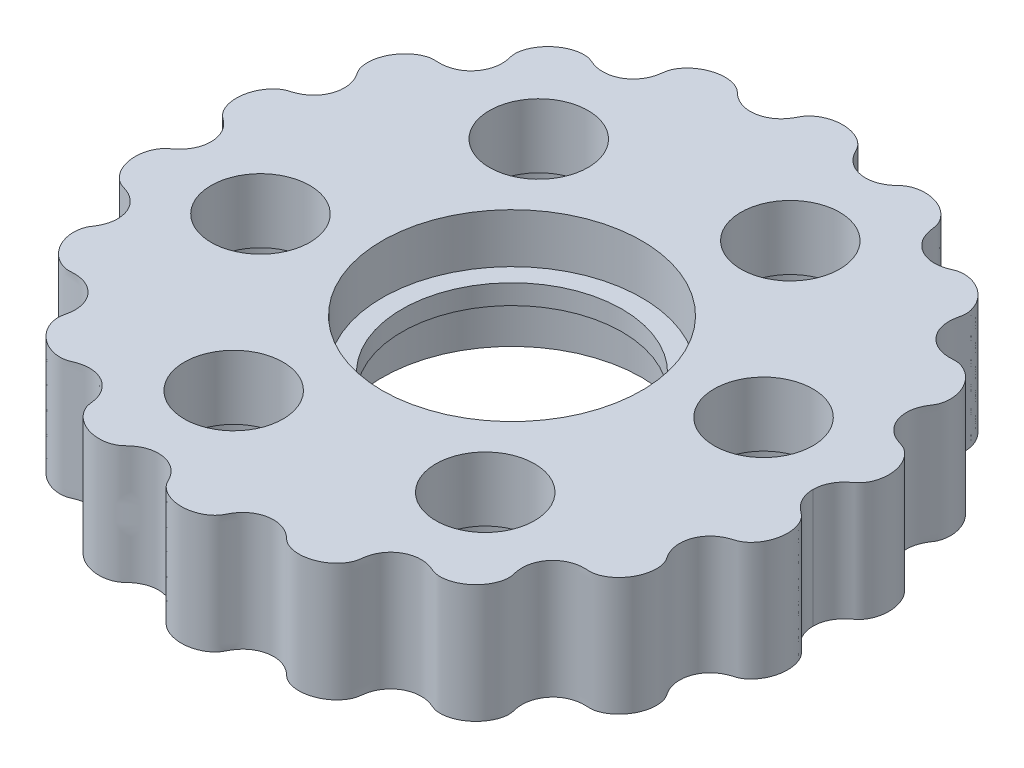
from build123d import *

# Parameters (mm, degrees)
BOSS_EXTRUDE1_DEPTH = 12
SKETCH2_R           = 13.15
CUT_EXTRUDE1_DEPTH  = 5
CUT_EXTRUDE2_START  = -5
SKETCH3_R           = 13.15
CUT_EXTRUDE2_DEPTH  = 5
SKETCH4_R           = 11.15
CUT_EXTRUDE3_DEPTH  = 49.565975451
SKETCH5_R           = 6.15
CUT_EXTRUDE4_DEPTH  = 5.5
SKETCH7_R           = 5
CUT_EXTRUDE5_DEPTH  = 48.506883401
CIRPATTERN1_COUNT   = 6


# Read off the part's stored shape, not the designer's step: Boss-Extrude1
with BuildPart() as part:
    # Boss-Extrude1 outline → Boss-Extrude1 (new body)
    with BuildSketch(Plane(origin=(0, 0, 0), x_dir=(1, 0, 0), z_dir=(0, 1, 0))):
        with BuildLine():
            add(Edge.make_bspline(
                [(-30.499999085, 0), (-30.499999175, -0.010492819), (-30.500691598, -0.162801588), (-30.521411377, -0.456943393), (-30.60687887, -0.883817919), (-30.80003143, -1.368056975), (-31.044007723, -1.775169688), (-31.325703126, -2.125056175), (-31.590756879, -2.382187589), (-31.849606625, -2.588359591), (-32.094052825, -2.769126177), (-32.284530428, -2.941107432), (-32.45615239, -3.146584597), (-32.609425913, -3.378646405), (-32.763947309, -3.674818071), (-32.903571398, -4.039160413), (-33.045989809, -4.621618508), (-33.087120433, -5.449381257), (-32.937194441, -6.258982918), (-32.61230154, -7.000333705), (-32.271226262, -7.494720192), (-32.019908426, -7.778290863), (-31.769218305, -8.003024352), (-31.529780832, -8.173830265), (-31.276753274, -8.311619838), (-31.011944101, -8.404178458), (-30.749402322, -8.480858964), (-30.497667969, -8.571876808), (-30.241927917, -8.683548266), (-29.986243002, -8.821967156), (-29.676679256, -9.027661698), (-29.331445279, -9.326854778), (-28.992040898, -9.733219087), (-28.704107226, -10.256942243), (-28.522577148, -10.824275994), (-28.452854891, -11.407333385), (-28.488060733, -11.92630102), (-28.589845056, -12.370337834), (-28.716403333, -12.714525216), (-28.836561026, -12.969318867), (-28.962226742, -13.193151466), (-29.085829976, -13.389048228), (-29.220719808, -13.594131406), (-29.340146042, -13.82476592), (-29.430391624, -14.082852476), (-29.493643838, -14.36210599), (-29.532855371, -14.691688028), (-29.535518385, -15.069118274), (-29.484893169, -15.515830574), (-29.35650675, -16.020958669), (-29.092942729, -16.667756875), (-28.709006495, -17.254073331), (-28.241816804, -17.740949419), (-27.690154521, -18.129754208), (-27.28119716, -18.334169834), (-26.885000972, -18.459364675), (-26.517146193, -18.510550206), (-26.221274848, -18.500641833), (-25.856897799, -18.479916929), (-25.491483562, -18.493737102), (-25.127858663, -18.548128201), (-24.702165675, -18.666574341), (-24.288563977, -18.839137858), (-23.843442434, -19.115048674), (-23.410547993, -19.516009595), (-23.065752538, -19.985452755), (-22.819462403, -20.497388778), (-22.683755131, -20.988837886), (-22.631614112, -21.444484037), (-22.637804746, -21.81835899), (-22.669724735, -22.109274444), (-22.715315125, -22.362908346), (-22.764801722, -22.58010395), (-22.816492345, -22.810310944), (-22.842935536, -23.058295646), (-22.836840431, -23.320437872), (-22.800567289, -23.592723848), (-22.724493742, -23.915362284), (-22.593257298, -24.281127511), (-22.386227124, -24.689408547), (-22.085311278, -25.121288655), (-21.606200529, -25.640725559), (-21.04785269, -26.050457906), (-20.450105873, -26.338151172), (-19.871291213, -26.490725482), (-19.506020896, -26.542502949), (-19.16782053, -26.551437218), (-18.861814377, -26.523908301), (-18.565877351, -26.45743559), (-18.291525054, -26.34331334), (-17.958528276, -26.202781675), (-17.54317837, -26.07054566), (-17.030700231, -25.984231535), (-16.424475137, -25.996763262), (-15.820867461, -26.130090758), (-15.249714898, -26.383641646), (-14.739252597, -26.747920188), (-14.315548374, -27.203217538), (-13.994871292, -27.724976088), (-13.808937144, -28.217614993), (-13.713611458, -28.648871834), (-13.668418356, -29.011297177), (-13.629929171, -29.306946931), (-13.539294967, -29.597067659), (-13.410068961, -29.876144041), (-13.227782837, -30.173224783), (-12.986290492, -30.478430939), (-12.543832541, -30.913946499), (-11.95970063, -31.297261567), (-11.282105556, -31.574526313), (-10.452014742, -31.730414717), (-9.839096654, -31.730848992), (-9.309241563, -31.638989547), (-8.867289361, -31.479831305), (-8.578045527, -31.335516465), (-8.320012243, -31.149083082), (-8.097371044, -30.930993351), (-7.821799247, -30.690653756), (-7.47292356, -30.437834205), (-7.01694869, -30.200071645), (-6.443080974, -30.025249665), (-5.83418155, -29.964452287), (-5.224498816, -30.024481113), (-4.640821732, -30.202402896), (-4.09682771, -30.493163872), (-3.62777909, -30.878506743), (-3.29210175, -31.283207956), (-3.059200328, -31.663110182), (-2.9001788, -31.981774035), (-2.761353801, -32.235427892), (-2.579273144, -32.464858975), (-2.369706257, -32.672026051), (-2.09703076, -32.886892763), (-1.756270245, -33.095004832), (-1.188568065, -33.348068895), (-0.365615859, -33.53430372), (0.473440825, -33.52219997), (1.273147664, -33.318270639), (1.81456259, -33.062504094), (2.135143608, -32.859561837), (2.395795297, -32.648529952), (2.600080171, -32.441319452), (2.777665184, -32.210325215), (2.91331922, -31.95420075), (3.076217138, -31.632283867), (3.311396206, -31.257230813), (3.647275735, -30.860738511), (4.111684864, -30.484715044), (4.645588786, -30.200848431), (5.226183564, -30.024310105), (5.83418553, -29.9644552), (6.443078327, -30.025247732), (7.016950608, -30.200073046), (7.4729222, -30.437833212), (7.821800005, -30.690654309), (8.097370637, -30.930993055), (8.320012458, -31.14908324), (8.578045414, -31.335516382), (8.867289407, -31.47983134), (9.309241528, -31.638989521), (9.83909668, -31.730849011), (10.452014727, -31.730414706), (11.282105566, -31.57452632), (11.959700623, -31.297261561), (12.543832545, -30.913946502), (12.98629049, -30.478430938), (13.227782838, -30.173224784), (13.41006896, -29.87614404), (13.539294968, -29.597067659), (13.629929171, -29.30694693), (13.668418356, -29.011297177), (13.713611458, -28.648871834), (13.808937144, -28.217614993), (13.994871292, -27.724976088), (14.315548374, -27.203217538), (14.739252597, -26.747920188), (15.249714898, -26.383641646), (15.820867461, -26.130090758), (16.424475137, -25.996763262), (17.030700231, -25.984231535), (17.54317837, -26.07054566), (17.958528276, -26.202781675), (18.291525054, -26.34331334), (18.565877351, -26.45743559), (18.861814377, -26.523908301), (19.16782053, -26.551437218), (19.506020896, -26.542502949), (19.871291213, -26.490725482), (20.450105873, -26.338151172), (21.04785269, -26.050457906), (21.606200529, -25.640725559), (22.085311278, -25.121288655), (22.386227124, -24.689408547), (22.593257298, -24.281127511), (22.724493742, -23.915362284), (22.800567289, -23.592723848), (22.836840431, -23.320437872), (22.842935536, -23.058295646), (22.816492345, -22.810310944), (22.764801722, -22.58010395), (22.715315125, -22.362908346), (22.669724735, -22.109274444), (22.637804746, -21.81835899), (22.631614112, -21.444484037), (22.683755131, -20.988837886), (22.819462403, -20.497388778), (23.065752538, -19.985452755), (23.410547993, -19.516009595), (23.843442434, -19.115048674), (24.288563977, -18.839137858), (24.702165675, -18.666574341), (25.127858663, -18.548128201), (25.491483562, -18.493737102), (25.856897799, -18.479916929), (26.221274848, -18.500641833), (26.517146193, -18.510550206), (26.885000972, -18.459364675), (27.28119716, -18.334169834), (27.690154521, -18.129754208), (28.241816804, -17.740949419), (28.709006495, -17.254073331), (29.092942729, -16.667756875), (29.35650675, -16.020958669), (29.484893169, -15.515830574), (29.535518385, -15.069118274), (29.532855371, -14.691688028), (29.493643838, -14.36210599), (29.430391624, -14.082852476), (29.340146042, -13.82476592), (29.220719808, -13.594131406), (29.085829976, -13.389048228), (28.962226742, -13.193151466), (28.836561026, -12.969318867), (28.716403333, -12.714525216), (28.589845056, -12.370337834), (28.488060733, -11.92630102), (28.452854891, -11.407333385), (28.522577148, -10.824275994), (28.704107226, -10.256942243), (28.992040898, -9.733219087), (29.331445279, -9.326854778), (29.676679256, -9.027661698), (29.986243002, -8.821967156), (30.241927917, -8.683548266), (30.497667969, -8.571876808), (30.749402322, -8.480858964), (31.011944101, -8.404178458), (31.276753274, -8.311619838), (31.529780832, -8.173830265), (31.769218305, -8.003024352), (32.019908426, -7.778290863), (32.271226262, -7.494720192), (32.61230154, -7.000333705), (32.937194441, -6.258982918), (33.087120433, -5.449381257), (33.045989809, -4.621618508), (32.903571398, -4.039160413), (32.763947309, -3.674818071), (32.609425913, -3.378646404), (32.45615239, -3.146584598), (32.284530428, -2.941107431), (32.094052825, -2.769126179), (31.849606624, -2.588359587), (31.59075688, -2.382187596), (31.325703124, -2.125056164), (31.044007726, -1.775169702), (30.800031426, -1.368056953), (30.606878876, -0.883817954), (30.521411371, -0.456943359), (30.500691597, -0.162801583), (30.499999177, -0.010492821), (30.499999087, 0)],
                knots=[0.110052273, 0.110052273, 0.110052273, 0.110052273, 0.110052273, 0.110325765, 0.114022142, 0.117722321, 0.121335676, 0.123841108, 0.126346539, 0.129404254, 0.130933112, 0.13246197, 0.134268785, 0.1360756, 0.137887882, 0.139700164, 0.142960539, 0.146220913, 0.153462311, 0.161135349, 0.164140391, 0.167145434, 0.169068277, 0.17099112, 0.172896042, 0.174800963, 0.176543347, 0.178285731, 0.180028114, 0.181770498, 0.183811634, 0.18585277, 0.18970137, 0.193635426, 0.197527317, 0.201332127, 0.205132655, 0.208850144, 0.211007871, 0.213165599, 0.21467506, 0.216184522, 0.217693984, 0.219203446, 0.221069572, 0.222935697, 0.224795639, 0.22665558, 0.229704369, 0.232753158, 0.236476624, 0.240200089, 0.24784116, 0.250878244, 0.253915328, 0.257740893, 0.259700206, 0.261659519, 0.263549239, 0.265438959, 0.269218398, 0.271162142, 0.273105887, 0.276937324, 0.280861097, 0.284727203, 0.28839057, 0.292029512, 0.295588307, 0.297946203, 0.3003041, 0.3017559, 0.303207699, 0.304659499, 0.306111298, 0.307900602, 0.309689905, 0.311474966, 0.313260027, 0.316527057, 0.319794087, 0.323365877, 0.326937666, 0.334884636, 0.337696823, 0.340509011, 0.342495571, 0.344482131, 0.346493459, 0.348504786, 0.350358222, 0.352211657, 0.355918528, 0.359835531, 0.363833606, 0.367915804, 0.371924364, 0.376013451, 0.380068173, 0.384018447, 0.387782933, 0.389665176, 0.391547419, 0.393542886, 0.395538352, 0.397544662, 0.399550971, 0.402605463, 0.405659955, 0.413675299, 0.417599554, 0.421523809, 0.427581515, 0.429547594, 0.431513674, 0.433745812, 0.435977951, 0.437802071, 0.43962619, 0.44327443, 0.447180354, 0.451131412, 0.455168481, 0.459117657, 0.463045972, 0.466931719, 0.471148815, 0.474833175, 0.476675355, 0.478517535, 0.480435451, 0.482353367, 0.484271351, 0.486189335, 0.489462878, 0.492736421, 0.500412802, 0.507997592, 0.511034971, 0.51407235, 0.51596915, 0.517865949, 0.519756263, 0.521646576, 0.52352597, 0.525405365, 0.529164154, 0.533153633, 0.53699803, 0.540882342, 0.544831519, 0.548868587, 0.552819646, 0.55672557, 0.56037381, 0.562197929, 0.564022049, 0.566254188, 0.568486326, 0.570452406, 0.572418485, 0.578476191, 0.582400446, 0.586324701, 0.594340045, 0.597394537, 0.600449029, 0.602455338, 0.604461648, 0.606457114, 0.608452581, 0.610334824, 0.612217067, 0.615981553, 0.619931826, 0.623986549, 0.628075635, 0.632084196, 0.636166393, 0.640164469, 0.644081472, 0.647788343, 0.649641778, 0.651495213, 0.653506541, 0.655517868, 0.657504429, 0.659490989, 0.662303177, 0.665115364, 0.673062334, 0.676634123, 0.680205913, 0.683472943, 0.686739973, 0.688525034, 0.690310094, 0.692099398, 0.693888702, 0.695340501, 0.696792301, 0.6982441, 0.6996959, 0.702053796, 0.704411693, 0.707970488, 0.71160943, 0.715272796, 0.719138902, 0.723062676, 0.726894113, 0.728837857, 0.730781602, 0.734561041, 0.736450761, 0.738340481, 0.740299794, 0.742259107, 0.746084672, 0.749121756, 0.75215884, 0.75979991, 0.763523376, 0.767246842, 0.770295631, 0.77334442, 0.775204361, 0.777064302, 0.778930428, 0.780796554, 0.782306016, 0.783815478, 0.78532494, 0.786834401, 0.788992129, 0.791149856, 0.794867345, 0.798667872, 0.802472683, 0.806364574, 0.81029863, 0.81414723, 0.816188366, 0.818229502, 0.819971885, 0.821714269, 0.823456653, 0.825199037, 0.827103958, 0.82900888, 0.830931723, 0.832854566, 0.835859608, 0.838864651, 0.846537689, 0.853779087, 0.857039461, 0.860299835, 0.862112118, 0.8639244, 0.865731215, 0.86753803, 0.869066888, 0.870595745, 0.873653461, 0.876158892, 0.878664324, 0.882277678, 0.885977858, 0.889674235, 0.889947726, 0.889947726, 0.889947726, 0.889947726, 0.889947726], degree=4))
            add(Edge.make_bspline(
                [(30.499999087, 0), (30.499999177, 0.010492821), (30.500691597, 0.162801583), (30.521411371, 0.456943359), (30.606878876, 0.883817954), (30.800031426, 1.368056953), (31.044007726, 1.775169702), (31.325703124, 2.125056164), (31.59075688, 2.382187596), (31.849606624, 2.588359587), (32.094052825, 2.769126179), (32.284530428, 2.941107431), (32.45615239, 3.146584598), (32.609425913, 3.378646404), (32.763947309, 3.674818071), (32.903571398, 4.039160413), (33.045989809, 4.621618508), (33.087120433, 5.449381257), (32.937194441, 6.258982918), (32.61230154, 7.000333705), (32.271226261, 7.494720192), (32.019908426, 7.778290863), (31.769218305, 8.003024352), (31.529780832, 8.173830265), (31.276753274, 8.311619838), (31.011944101, 8.404178458), (30.749402322, 8.480858964), (30.497667969, 8.571876808), (30.241927917, 8.683548266), (29.986243002, 8.821967156), (29.676679256, 9.027661698), (29.331445279, 9.326854778), (28.992040898, 9.733219087), (28.704107226, 10.256942243), (28.522577148, 10.824275994), (28.452854891, 11.407333385), (28.488060733, 11.92630102), (28.589845056, 12.370337834), (28.716403333, 12.714525216), (28.836561026, 12.969318867), (28.962226742, 13.193151466), (29.085829976, 13.389048228), (29.220719808, 13.594131406), (29.340146042, 13.82476592), (29.430391624, 14.082852476), (29.493643838, 14.36210599), (29.532855371, 14.691688028), (29.535518385, 15.069118274), (29.484893169, 15.515830574), (29.35650675, 16.020958669), (29.092942729, 16.667756875), (28.709006495, 17.254073331), (28.241816804, 17.740949419), (27.690154521, 18.129754208), (27.28119716, 18.334169834), (26.885000972, 18.459364675), (26.517146193, 18.510550206), (26.221274848, 18.500641833), (25.856897799, 18.479916929), (25.491483562, 18.493737102), (25.127858663, 18.548128201), (24.702165675, 18.666574341), (24.288563977, 18.839137858), (23.843442434, 19.115048674), (23.410547992, 19.516009595), (23.065752538, 19.985452755), (22.819462403, 20.497388778), (22.683755131, 20.988837886), (22.631614112, 21.444484037), (22.637804746, 21.81835899), (22.669724735, 22.109274444), (22.715315125, 22.362908346), (22.764801722, 22.58010395), (22.816492345, 22.810310944), (22.842935536, 23.058295646), (22.836840431, 23.320437872), (22.800567289, 23.592723848), (22.724493741, 23.915362284), (22.593257298, 24.281127511), (22.386227124, 24.689408547), (22.085311278, 25.121288655), (21.606200529, 25.640725559), (21.04785269, 26.050457906), (20.450105873, 26.338151172), (19.871291213, 26.490725482), (19.506020896, 26.542502949), (19.16782053, 26.551437218), (18.861814377, 26.523908301), (18.565877351, 26.45743559), (18.291525054, 26.34331334), (17.958528276, 26.202781675), (17.54317837, 26.07054566), (17.030700231, 25.984231535), (16.424475137, 25.996763262), (15.820867461, 26.130090758), (15.249714898, 26.383641646), (14.739252597, 26.747920188), (14.315548374, 27.203217538), (13.994871292, 27.724976088), (13.808937144, 28.217614993), (13.713611458, 28.648871834), (13.668418356, 29.011297177), (13.629929171, 29.30694693), (13.539294968, 29.597067659), (13.41006896, 29.87614404), (13.227782838, 30.173224784), (12.98629049, 30.478430938), (12.543832545, 30.913946502), (11.959700623, 31.297261561), (11.282105566, 31.57452632), (10.452014727, 31.730414706), (9.83909668, 31.730849011), (9.309241528, 31.638989521), (8.867289407, 31.47983134), (8.578045414, 31.335516382), (8.320012458, 31.14908324), (8.097370637, 30.930993055), (7.821800005, 30.690654309), (7.4729222, 30.437833212), (7.016950608, 30.200073046), (6.443078327, 30.025247732), (5.83418553, 29.9644552), (5.226183564, 30.024310105), (4.645588786, 30.200848431), (4.111684864, 30.484715044), (3.647275735, 30.860738511), (3.311396206, 31.257230813), (3.076217138, 31.632283867), (2.91331922, 31.95420075), (2.777665184, 32.210325215), (2.600080171, 32.441319452), (2.395795297, 32.648529952), (2.135143607, 32.859561837), (1.81456259, 33.062504094), (1.273147664, 33.318270639), (0.473440825, 33.52219997), (-0.365615859, 33.53430372), (-1.188568065, 33.348068895), (-1.756270245, 33.095004832), (-2.09703076, 32.886892763), (-2.369706258, 32.672026051), (-2.579273144, 32.464858975), (-2.761353801, 32.235427892), (-2.9001788, 31.981774035), (-3.059200328, 31.663110182), (-3.29210175, 31.283207956), (-3.62777909, 30.878506743), (-4.09682771, 30.493163872), (-4.640821733, 30.202402896), (-5.224498816, 30.024481113), (-5.83418155, 29.964452287), (-6.443080974, 30.025249665), (-7.01694869, 30.200071645), (-7.47292356, 30.437834205), (-7.821799247, 30.690653756), (-8.097371044, 30.930993351), (-8.320012243, 31.149083082), (-8.578045527, 31.335516465), (-8.867289361, 31.479831305), (-9.309241563, 31.638989546), (-9.839096654, 31.730848992), (-10.452014742, 31.730414716), (-11.282105556, 31.574526313), (-11.95970063, 31.297261567), (-12.543832541, 30.913946499), (-12.986290492, 30.478430939), (-13.227782837, 30.173224783), (-13.410068961, 29.876144041), (-13.539294967, 29.597067659), (-13.629929171, 29.306946931), (-13.668418356, 29.011297177), (-13.713611458, 28.648871834), (-13.808937144, 28.217614993), (-13.994871292, 27.724976088), (-14.315548374, 27.203217538), (-14.739252597, 26.747920188), (-15.249714898, 26.383641646), (-15.820867461, 26.130090758), (-16.424475137, 25.996763261), (-17.030700231, 25.984231535), (-17.54317837, 26.07054566), (-17.958528276, 26.202781675), (-18.291525054, 26.34331334), (-18.565877351, 26.45743559), (-18.861814377, 26.523908301), (-19.16782053, 26.551437217), (-19.506020896, 26.542502949), (-19.871291213, 26.490725482), (-20.450105873, 26.338151172), (-21.04785269, 26.050457906), (-21.606200529, 25.640725559), (-22.085311278, 25.121288655), (-22.386227124, 24.689408547), (-22.593257298, 24.281127511), (-22.724493742, 23.915362284), (-22.800567289, 23.592723848), (-22.836840431, 23.320437872), (-22.842935536, 23.058295646), (-22.816492345, 22.810310944), (-22.764801722, 22.58010395), (-22.715315125, 22.362908346), (-22.669724735, 22.109274443), (-22.637804746, 21.81835899), (-22.631614112, 21.444484037), (-22.683755131, 20.988837886), (-22.819462403, 20.497388777), (-23.065752538, 19.985452755), (-23.410547993, 19.516009595), (-23.843442434, 19.115048674), (-24.288563977, 18.839137858), (-24.702165675, 18.666574341), (-25.127858663, 18.548128201), (-25.491483562, 18.493737102), (-25.856897799, 18.479916929), (-26.221274848, 18.500641833), (-26.517146193, 18.510550206), (-26.885000972, 18.459364675), (-27.28119716, 18.334169834), (-27.690154521, 18.129754208), (-28.241816804, 17.740949419), (-28.709006496, 17.254073331), (-29.092942729, 16.667756875), (-29.35650675, 16.020958669), (-29.484893169, 15.515830574), (-29.535518385, 15.069118274), (-29.532855371, 14.691688028), (-29.493643838, 14.36210599), (-29.430391624, 14.082852476), (-29.340146042, 13.82476592), (-29.220719808, 13.594131406), (-29.085829976, 13.389048227), (-28.962226742, 13.193151466), (-28.836561026, 12.969318867), (-28.716403333, 12.714525216), (-28.589845056, 12.370337834), (-28.488060733, 11.92630102), (-28.452854891, 11.407333385), (-28.522577148, 10.824275994), (-28.704107226, 10.256942242), (-28.992040898, 9.733219087), (-29.331445279, 9.326854778), (-29.676679256, 9.027661698), (-29.986243002, 8.821967156), (-30.241927917, 8.683548266), (-30.497667969, 8.571876808), (-30.749402322, 8.480858964), (-31.011944101, 8.404178458), (-31.276753274, 8.311619838), (-31.529780832, 8.173830265), (-31.769218305, 8.003024352), (-32.019908426, 7.778290863), (-32.271226262, 7.494720192), (-32.61230154, 7.000333705), (-32.937194441, 6.258982918), (-33.087120433, 5.449381257), (-33.045989809, 4.621618508), (-32.903571398, 4.039160413), (-32.763947309, 3.674818071), (-32.609425913, 3.378646405), (-32.45615239, 3.146584597), (-32.284530428, 2.941107431), (-32.094052825, 2.769126177), (-31.849606625, 2.588359591), (-31.590756879, 2.382187589), (-31.325703126, 2.125056175), (-31.044007723, 1.775169688), (-30.80003143, 1.368056975), (-30.60687887, 0.883817919), (-30.521411377, 0.456943393), (-30.500691598, 0.162801588), (-30.499999175, 0.010492819), (-30.499999085, 0)],
                knots=[0.110052273, 0.110052273, 0.110052273, 0.110052273, 0.110052273, 0.110325765, 0.114022142, 0.117722321, 0.121335676, 0.123841108, 0.126346539, 0.129404254, 0.130933112, 0.13246197, 0.134268785, 0.1360756, 0.137887882, 0.139700164, 0.142960539, 0.146220913, 0.153462311, 0.161135349, 0.164140391, 0.167145434, 0.169068277, 0.17099112, 0.172896042, 0.174800963, 0.176543347, 0.178285731, 0.180028115, 0.181770498, 0.183811634, 0.18585277, 0.18970137, 0.193635426, 0.197527317, 0.201332128, 0.205132655, 0.208850144, 0.211007871, 0.213165599, 0.21467506, 0.216184522, 0.217693984, 0.219203446, 0.221069572, 0.222935697, 0.224795639, 0.22665558, 0.229704369, 0.232753158, 0.236476624, 0.24020009, 0.24784116, 0.250878244, 0.253915328, 0.257740893, 0.259700206, 0.261659519, 0.263549239, 0.265438959, 0.269218398, 0.271162143, 0.273105887, 0.276937324, 0.280861097, 0.284727203, 0.28839057, 0.292029512, 0.295588307, 0.297946204, 0.3003041, 0.3017559, 0.303207699, 0.304659499, 0.306111298, 0.307900602, 0.309689905, 0.311474966, 0.313260027, 0.316527057, 0.319794087, 0.323365877, 0.326937666, 0.334884636, 0.337696823, 0.340509011, 0.342495571, 0.344482131, 0.346493459, 0.348504786, 0.350358222, 0.352211657, 0.355918528, 0.359835531, 0.363833606, 0.367915804, 0.371924364, 0.376013451, 0.380068174, 0.384018447, 0.387782933, 0.389665176, 0.391547419, 0.393542886, 0.395538352, 0.397544662, 0.399550971, 0.402605463, 0.405659955, 0.413675299, 0.417599554, 0.421523809, 0.427581515, 0.429547594, 0.431513674, 0.433745812, 0.435977951, 0.437802071, 0.43962619, 0.44327443, 0.447180354, 0.451131413, 0.455168481, 0.459117658, 0.46300197, 0.466846367, 0.470835846, 0.474594635, 0.476474029, 0.478353424, 0.480243737, 0.482134051, 0.48403085, 0.48592765, 0.488965029, 0.492002408, 0.499587198, 0.507263579, 0.510537122, 0.513810665, 0.515728649, 0.517646633, 0.519564549, 0.521482465, 0.523324645, 0.525166825, 0.528851185, 0.533068281, 0.536954028, 0.540882342, 0.544831519, 0.548868587, 0.552819646, 0.55672557, 0.56037381, 0.562197929, 0.564022049, 0.566254188, 0.568486326, 0.570452406, 0.572418485, 0.578476191, 0.582400446, 0.586324701, 0.594340045, 0.597394537, 0.600449029, 0.602455338, 0.604461648, 0.606457114, 0.608452581, 0.610334824, 0.612217067, 0.615981553, 0.619931826, 0.623986549, 0.628075636, 0.632084196, 0.636166394, 0.640164469, 0.644081472, 0.647788343, 0.649641778, 0.651495214, 0.653506541, 0.655517869, 0.657504429, 0.659490989, 0.662303177, 0.665115364, 0.673062334, 0.676634123, 0.680205913, 0.683472943, 0.686739973, 0.688525034, 0.690310095, 0.692099398, 0.693888702, 0.695340501, 0.696792301, 0.6982441, 0.6996959, 0.702053796, 0.704411693, 0.707970488, 0.71160943, 0.715272797, 0.719138903, 0.723062676, 0.726894113, 0.728837857, 0.730781602, 0.734561041, 0.736450761, 0.738340481, 0.740299794, 0.742259107, 0.746084672, 0.749121756, 0.75215884, 0.75979991, 0.763523376, 0.767246842, 0.770295631, 0.77334442, 0.775204361, 0.777064303, 0.778930428, 0.780796554, 0.782306016, 0.783815478, 0.78532494, 0.786834401, 0.788992129, 0.791149856, 0.794867345, 0.798667872, 0.802472683, 0.806364574, 0.81029863, 0.81414723, 0.816188366, 0.818229502, 0.819971885, 0.821714269, 0.823456653, 0.825199037, 0.827103958, 0.82900888, 0.830931723, 0.832854566, 0.835859609, 0.838864651, 0.846537689, 0.853779087, 0.857039461, 0.860299836, 0.862112118, 0.8639244, 0.865731215, 0.86753803, 0.869066888, 0.870595746, 0.873653461, 0.876158892, 0.878664324, 0.882277679, 0.885977858, 0.889674235, 0.889947726, 0.889947726, 0.889947726, 0.889947726, 0.889947726], degree=4))
        make_face()
    extrude(amount=BOSS_EXTRUDE1_DEPTH)

    # Sketch2 → Cut-Extrude1 (cut)
    with BuildSketch(Plane(origin=(0, 12, 0), x_dir=(1, 0, 0), z_dir=(0, 1, 0))):
        with Locations(Location((0, 0, 0), (0, 0, 270))):
            Circle(SKETCH2_R)
    extrude(amount=-CUT_EXTRUDE1_DEPTH, mode=Mode.SUBTRACT)

    # Sketch3 → Cut-Extrude2 (cut)
    with BuildSketch(Plane.XZ.offset(CUT_EXTRUDE2_START)):
        with Locations(Location((0, 0, 0), (0, 0, 90))):
            Circle(SKETCH3_R)
    extrude(amount=CUT_EXTRUDE2_DEPTH, mode=Mode.SUBTRACT)

    # Sketch4 → Cut-Extrude3 (cut, through all)
    with BuildSketch(Plane.XZ):
        with Locations(Location((0, 0, 0), (0, 0, 270))):
            Circle(SKETCH4_R)
    extrude(amount=-CUT_EXTRUDE3_DEPTH, mode=Mode.SUBTRACT)

    # Sketch5 → Cut-Extrude4 (cut)
    with BuildSketch(Plane.XZ):
        with Locations(Location((-21.665771198, 3.820256325, 0), (0, 0, 270))):
            Circle(SKETCH5_R)
    cut_extrude4 = extrude(amount=-CUT_EXTRUDE4_DEPTH, mode=Mode.SUBTRACT)

    # Sketch7 → Cut-Extrude5 (cut, through all)
    with BuildSketch(Plane.XZ.offset(-5.5)):
        with Locations(Location((-21.665771198, 3.820256325, 0), (0, 0, 270))):
            Circle(SKETCH7_R)
    cut_extrude5 = extrude(amount=-CUT_EXTRUDE5_DEPTH, mode=Mode.SUBTRACT)

    # CirPattern1: Cut-Extrude4, Cut-Extrude5 ×6 about axis
    cirpattern1_axis = Axis((0, 0, 0), (0, 1, 0))
    add([cut_extrude4.rotate(cirpattern1_axis, i * 360 / CIRPATTERN1_COUNT) for i in range(1, CIRPATTERN1_COUNT)], mode=Mode.SUBTRACT)
    add([cut_extrude5.rotate(cirpattern1_axis, i * 360 / CIRPATTERN1_COUNT) for i in range(1, CIRPATTERN1_COUNT)], mode=Mode.SUBTRACT)


solid = part.part
